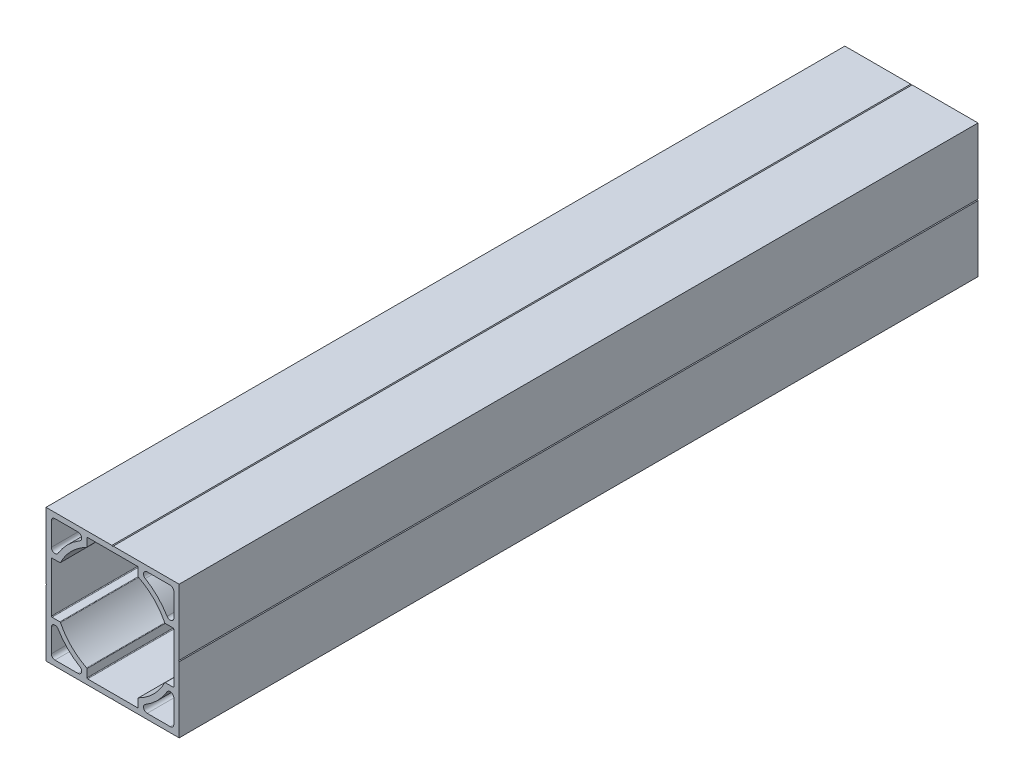
from build123d import *

# Parameters (mm, degrees)
BOSS_EXTRUDE1_DEPTH = 152.4


with BuildPart() as part:
    # Sketch1 → Boss-Extrude1 (new body)
    with BuildSketch(Plane.XY):
        Polygon((25.4, 12.827), (25.4, 25.4), (12.827, 25.4), (12.7, 25.273), (12.573, 25.4), (0, 25.4), (0, 12.827), (0.127, 12.7), (0, 12.573), (0, 0), (12.573, 0), (12.7, 0.127), (12.827, 0), (25.4, 0), (25.4, 12.573), (25.273, 12.7), align=None)
        with BuildLine():
            Line((1.707589026, 1.016), (6.102910974, 1.016))
            ThreePointArc((6.102910974, 1.016), (6.769395501, 1.522944081), (6.458795739, 2.30058263))
            ThreePointArc((6.458795739, 2.30058263), (4.123855404, 4.123855404), (2.30058263, 6.458795739))
            ThreePointArc((2.30058263, 6.458795739), (1.522944081, 6.769395501), (1.016, 6.102910974))
            Line((1.016, 6.102910974), (1.016, 1.707589026))
            ThreePointArc((1.016, 1.707589026), (1.218561736, 1.218561736), (1.707589026, 1.016))
        make_face(mode=Mode.SUBTRACT)
        with BuildLine():
            Line((1.143, 7.8105), (2.642113144, 7.8105))
            ThreePointArc((2.642113144, 7.8105), (2.708934476, 7.791499581), (2.755761583, 7.740183616))
            ThreePointArc((2.755761583, 7.740183616), (4.842275894, 4.842275894), (7.740183616, 2.755761583))
            ThreePointArc((7.740183616, 2.755761583), (7.791499582, 2.708934476), (7.8105, 2.642113144))
            Line((7.8105, 2.642113144), (7.8105, 1.143))
            ThreePointArc((7.8105, 1.143), (7.847697439, 1.053197439), (7.9375, 1.016))
            Line((7.9375, 1.016), (17.4625, 1.016))
            ThreePointArc((17.4625, 1.016), (17.552302561, 1.053197439), (17.5895, 1.143))
            Line((17.5895, 1.143), (17.5895, 2.642113144))
            ThreePointArc((17.5895, 2.642113144), (17.608500419, 2.708934476), (17.659816384, 2.755761583))
            ThreePointArc((17.659816384, 2.755761583), (20.557724106, 4.842275894), (22.644238417, 7.740183616))
            ThreePointArc((22.644238417, 7.740183616), (22.691065524, 7.791499582), (22.757886856, 7.8105))
            Line((22.757886856, 7.8105), (24.257, 7.8105))
            ThreePointArc((24.257, 7.8105), (24.346802561, 7.847697439), (24.384, 7.9375))
            Line((24.384, 7.9375), (24.384, 17.4625))
            ThreePointArc((24.384, 17.4625), (24.346802561, 17.552302561), (24.257, 17.5895))
            Line((24.257, 17.5895), (22.757886856, 17.5895))
            ThreePointArc((22.757886856, 17.5895), (22.691065524, 17.608500419), (22.644238417, 17.659816384))
            ThreePointArc((22.644238417, 17.659816384), (20.557724106, 20.557724106), (17.659816384, 22.644238417))
            ThreePointArc((17.659816384, 22.644238417), (17.608500418, 22.691065524), (17.5895, 22.757886856))
            Line((17.5895, 22.757886856), (17.5895, 24.257))
            ThreePointArc((17.5895, 24.257), (17.552302561, 24.346802561), (17.4625, 24.384))
            Line((17.4625, 24.384), (7.9375, 24.384))
            ThreePointArc((7.9375, 24.384), (7.847697439, 24.346802561), (7.8105, 24.257))
            Line((7.8105, 24.257), (7.8105, 22.757886856))
            ThreePointArc((7.8105, 22.757886856), (7.791499581, 22.691065524), (7.740183616, 22.644238417))
            ThreePointArc((7.740183616, 22.644238417), (4.842275894, 20.557724106), (2.755761583, 17.659816384))
            ThreePointArc((2.755761583, 17.659816384), (2.708934476, 17.608500418), (2.642113144, 17.5895))
            Line((2.642113144, 17.5895), (1.143, 17.5895))
            ThreePointArc((1.143, 17.5895), (1.053197439, 17.552302561), (1.016, 17.4625))
            Line((1.016, 17.4625), (1.016, 7.9375))
            ThreePointArc((1.016, 7.9375), (1.053197439, 7.847697439), (1.143, 7.8105))
        make_face(mode=Mode.SUBTRACT)
        with BuildLine():
            Line((1.016, 23.692410974), (1.016, 19.297089026))
            ThreePointArc((1.016, 19.297089026), (1.522944081, 18.630604499), (2.30058263, 18.941204261))
            ThreePointArc((2.30058263, 18.941204261), (4.123855404, 21.276144596), (6.458795739, 23.09941737))
            ThreePointArc((6.458795739, 23.09941737), (6.769395501, 23.877055919), (6.102910974, 24.384))
            Line((6.102910974, 24.384), (1.707589026, 24.384))
            ThreePointArc((1.707589026, 24.384), (1.218561736, 24.181438264), (1.016, 23.692410974))
        make_face(mode=Mode.SUBTRACT)
        with BuildLine():
            Line((23.692410974, 24.384), (19.297089026, 24.384))
            ThreePointArc((19.297089026, 24.384), (18.630604499, 23.877055919), (18.941204261, 23.09941737))
            ThreePointArc((18.941204261, 23.09941737), (21.276144596, 21.276144596), (23.09941737, 18.941204261))
            ThreePointArc((23.09941737, 18.941204261), (23.877055919, 18.630604499), (24.384, 19.297089026))
            Line((24.384, 19.297089026), (24.384, 23.692410974))
            ThreePointArc((24.384, 23.692410974), (24.181438264, 24.181438264), (23.692410974, 24.384))
        make_face(mode=Mode.SUBTRACT)
        with BuildLine():
            Line((24.384, 1.707589026), (24.384, 6.102910974))
            ThreePointArc((24.384, 6.102910974), (23.877055919, 6.769395501), (23.09941737, 6.458795739))
            ThreePointArc((23.09941737, 6.458795739), (21.276144596, 4.123855404), (18.941204261, 2.30058263))
            ThreePointArc((18.941204261, 2.30058263), (18.630604499, 1.522944081), (19.297089026, 1.016))
            Line((19.297089026, 1.016), (23.692410974, 1.016))
            ThreePointArc((23.692410974, 1.016), (24.181438264, 1.218561736), (24.384, 1.707589026))
        make_face(mode=Mode.SUBTRACT)
    extrude(amount=BOSS_EXTRUDE1_DEPTH)


solid = part.part
